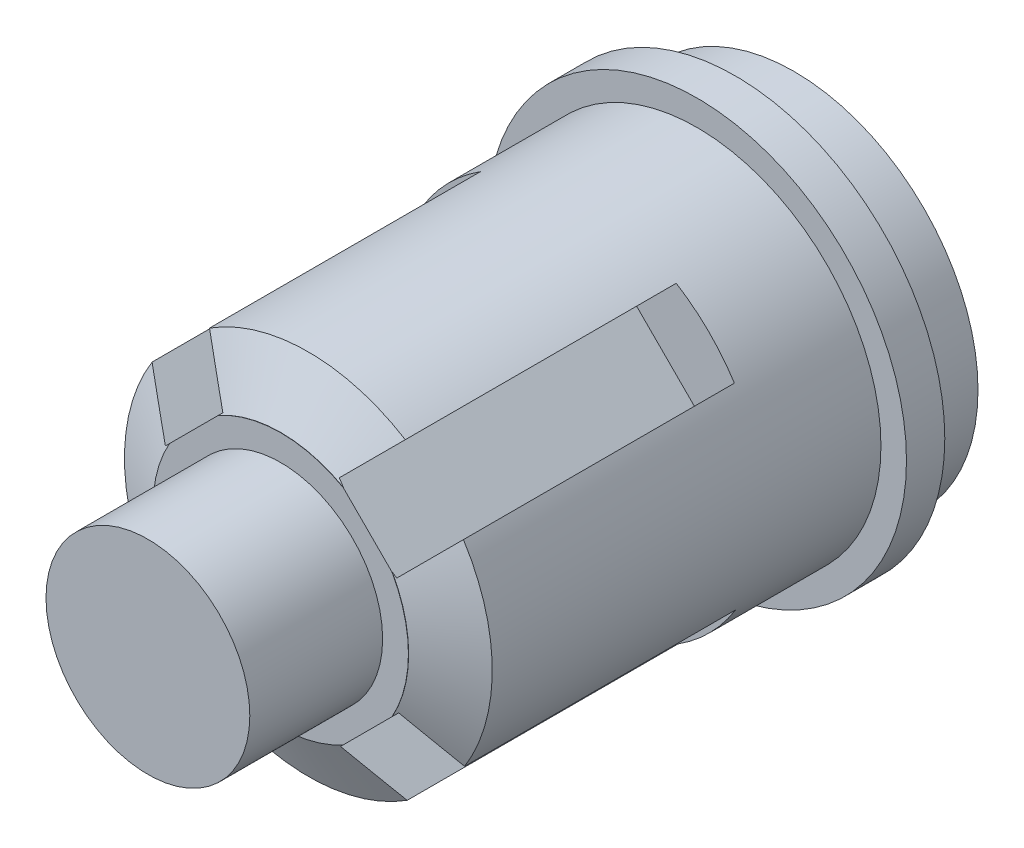
from build123d import *

# Parameters (mm, degrees)
EXTRUDE_1_DEPTH      = 0.3
EXTRUDE_1_DEPTH_BACK = 16.969059
SKETCH_1_R           = 7.2
SKETCH_1_2_R         = 7.2
EXTRUDE_2_DEPTH      = 2
SKETCH_2_R           = 3.99
EXTRUDE_3_DEPTH      = 6.330940566
SKETCH_2_3_R         = 5
SKETCH_2_3_R_2       = 3.99
EXTRUDE_4_DEPTH      = 1.130940566
CHAMFER_1_SIZE       = 2.3
CHAMFER_1_SIZE_2     = 1.121784954
EXTRUDE_START        = 0.3
SKETCH_3_R           = 8.2
SKETCH_3_R_2         = 7.2
EXTRUDE_5_DEPTH      = 1.5
CUT_EXTRUDE_START    = 0.1
SKETCH_5_R           = 31.525677416
CUT_EXTRUDE_1_DEPTH  = 412.780220489
CUT_EXTRUDE_2_DEPTH  = 5
MOVE_FACE_1_BY       = 0.8


with BuildPart() as part:
    # Эскиз1 → Бобышка-Вытянуть1 (new, two sides: drawn at the far end of the back side and taken through both)
    with BuildSketch(Plane.XY.offset(-EXTRUDE_1_DEPTH_BACK)):
        with Locations((-387.828180977, 102.977102389)):
            Circle(SKETCH_1_R)
        Polygon((-387.828180977, 97.956644243), (-382.80772283, 102.977102389), (-387.757470299, 108.068271214), (-392.848639123, 102.977102389), align=None, mode=Mode.SUBTRACT)
    extrude(amount=EXTRUDE_1_DEPTH + EXTRUDE_1_DEPTH_BACK)

    # Эскиз1<2> → Бобышка-Вытянуть2 (add)
    with BuildSketch(Plane.XY):
        with Locations((-387.828180977, 102.977102389)):
            Circle(SKETCH_1_2_R)
    extrude(amount=EXTRUDE_2_DEPTH)

    # Эскиз2 → Бобышка-Вытянуть3 (add)
    with BuildSketch(Plane.XY.offset(2)):
        with Locations((-387.828180977, 102.977102389)):
            Circle(SKETCH_2_R)
    extrude(amount=EXTRUDE_3_DEPTH)

    # Эскиз2<3> → Бобышка-Вытянуть4 (add)
    with BuildSketch(Plane.XY.offset(2)):
        with Locations(Location((-387.828180977, 102.977102389, 0), (0, 0, 180))):
            Circle(SKETCH_2_3_R)
        with Locations((-387.828180977, 102.977102389)):
            Circle(SKETCH_2_3_R_2, mode=Mode.SUBTRACT)
    extrude(amount=EXTRUDE_4_DEPTH)

    # Фаска1
    # the kernel refuses this chamfer: 2.3, 1.121784954 mm, written as the material it adds along each edge
    with BuildSketch(Plane(origin=(-387.828180977, 102.977102389, 2), x_dir=(-1, 0, 0), z_dir=(0, 1, 0))) as chamfer_1_piece_1_section:
        Polygon((5 + CHAMFER_1_SIZE, 0), (5, CHAMFER_1_SIZE_2), (5, 0), align=None)
    chamfer_1_piece_1 = revolve(axis=Axis((-387.828180977, 102.977102389, 2), (0, 0, 1)), mode=Mode.PRIVATE)
    chamfer_1_piece_1 = chamfer_1_piece_1 & Plane(origin=(-387.828180977, 102.977102389, 2.571661691), x_dir=(1, 0, 0), z_dir=(0, 0, -1)) * Cylinder(7.2, 30, mode=Mode.PRIVATE)
    add(chamfer_1_piece_1)

    # Эскиз3 → Бобышка-Вытянуть5 (add)
    with BuildSketch(Plane.XY.offset(-14.969059434).offset(EXTRUDE_START)):
        with Locations((-387.828180977, 102.977102389)):
            Circle(SKETCH_3_R)
        with Locations(Location((-387.828180977, 102.977102389, 0), (0, 0, 180))):
            Circle(SKETCH_3_R_2, mode=Mode.SUBTRACT)
    extrude(amount=EXTRUDE_5_DEPTH)

    # Эскиз5 → Вырез-Вытянуть1 (cut, through all)
    with BuildSketch(Plane(origin=(0, 0, -8.460000998), x_dir=(-1, 0, 0), z_dir=(0, 0, -1)).offset(CUT_EXTRUDE_START)):
        with Locations((387.828180977, 102.977102389)):
            Circle(SKETCH_5_R)
        with BuildLine():
            Line((385.524514896, 98.471917351), (383.813441597, 96.760844053))
            ThreePointArc((383.813441597, 96.760844053), (387.783841084, 95.57723523), (391.7681393, 96.713179624))
            Line((391.7681393, 96.713179624), (390.070624315, 98.410694608))
            Line((390.070624315, 98.410694608), (392.333366015, 100.673436308))
            Line((392.333366015, 100.673436308), (394.044439314, 98.962363009))
            ThreePointArc((394.044439314, 98.962363009), (395.228048136, 102.932762497), (394.092103743, 106.917060712))
            Line((394.092103743, 106.917060712), (392.394588758, 105.219545727))
            Line((392.394588758, 105.219545727), (390.131847058, 107.482287427))
            Line((390.131847058, 107.482287427), (391.842920357, 109.193360726))
            ThreePointArc((391.842920357, 109.193360726), (387.87252087, 110.376969549), (383.888222654, 109.241025155))
            Line((383.888222654, 109.241025155), (385.585737639, 107.54351017))
            Line((385.585737639, 107.54351017), (383.322995939, 105.280768471))
            Line((383.322995939, 105.280768471), (381.61192264, 106.99184177))
            ThreePointArc((381.61192264, 106.99184177), (380.428313818, 103.021442282), (381.564258211, 99.037144067))
            Line((381.564258211, 99.037144067), (383.261773196, 100.734659051))
            Line((383.261773196, 100.734659051), (385.524514896, 98.471917351))
        make_face(mode=Mode.SUBTRACT)
    extrude(amount=-CUT_EXTRUDE_1_DEPTH, mode=Mode.SUBTRACT)

    # Эскиз6 → Вырез-Вытянуть2 (cut)
    with BuildSketch(Plane(origin=(0, 0, -16.969059434), x_dir=(-1, 0, 0), z_dir=(0, 0, -1))):
        Polygon((392.467199832, 102.029977673), (391.330034344, 103.13555523), (392.279390791, 104.112036147), (393.414324548, 102.977102389), align=None)
        Polygon((383.255874897, 104.011882353), (384.259667783, 103.035972602), (383.236040731, 101.983099063), (382.245993053, 102.973146742), align=None)
        Polygon((386.771925298, 98.447214497), (387.844642377, 99.550580636), (388.931315265, 98.494093106), (387.828180977, 97.390958818), align=None)
        Polygon((387.753458546, 108.637968392), (386.741266863, 107.596856947), (387.74505975, 106.620947196), (388.743506224, 107.647920713), align=None)
    extrude(amount=-CUT_EXTRUDE_2_DEPTH, mode=Mode.SUBTRACT)

    # Move Face 1: a face moved inward by 0.8
    extrude(part.faces().sort_by_distance((-387.816313451, 103.000672615, 0))[0], amount=MOVE_FACE_1_BY, dir=(0, 0, 1), mode=Mode.SUBTRACT)


solid = part.part
